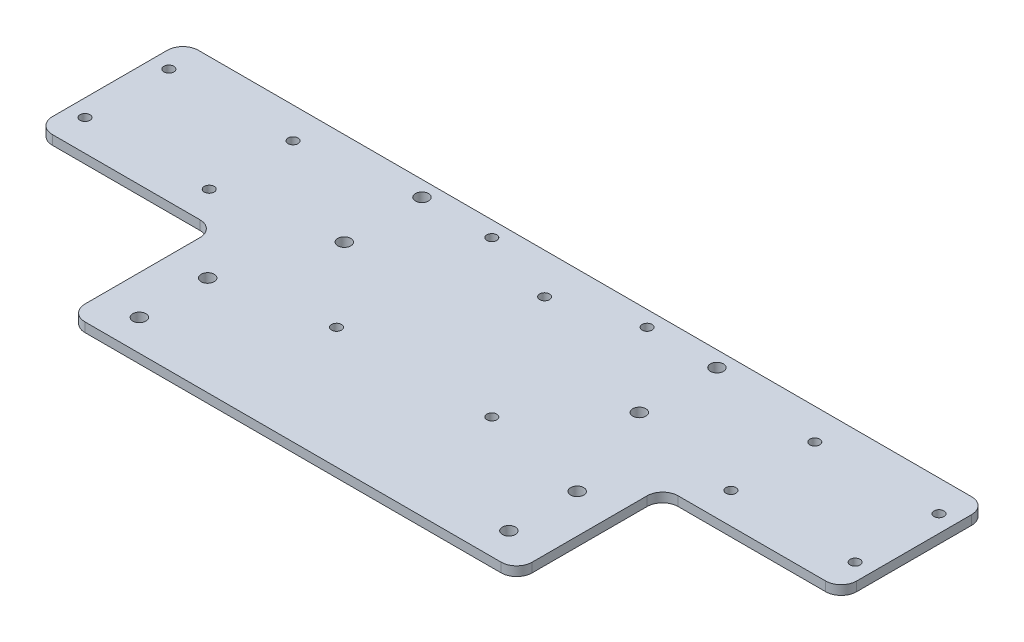
from build123d import *

# Parameters (mm, degrees)
SKETCH_1_R      = 2.1
SKETCH_1_R_2    = 1.6
EXTRUDE_1_DEPTH = 3
FILLET_1_R      = 5


with BuildPart() as part:
    # 草图1 → 凸台-拉伸1 (new body)
    with BuildSketch(Plane.XZ):
        Polygon((-72, 0), (72, 0), (72, -47), (129.5, -47), (129.5, -94), (-129.5, -94), (-129.5, -47), (-72, -47), align=None)
        with Locations((47.5, -89)):
            Circle(SKETCH_1_R, mode=Mode.SUBTRACT)
        with Locations((-124, -84)):
            Circle(SKETCH_1_R_2, mode=Mode.SUBTRACT)
        with Locations((-25, -89)):
            Circle(SKETCH_1_R_2, mode=Mode.SUBTRACT)
        with Locations((-59.5, -32)):
            Circle(SKETCH_1_R, mode=Mode.SUBTRACT)
        with Locations((-25, -39)):
            Circle(SKETCH_1_R_2, mode=Mode.SUBTRACT)
        with Locations((84, -84)):
            Circle(SKETCH_1_R_2, mode=Mode.SUBTRACT)
        with Locations((-59.5, -10)):
            Circle(SKETCH_1_R, mode=Mode.SUBTRACT)
        with Locations((47.5, -64)):
            Circle(SKETCH_1_R, mode=Mode.SUBTRACT)
        with Locations((-84, -57)):
            Circle(SKETCH_1_R_2, mode=Mode.SUBTRACT)
        with Locations((-124, -57)):
            Circle(SKETCH_1_R_2, mode=Mode.SUBTRACT)
        with Locations((-47.5, -64)):
            Circle(SKETCH_1_R, mode=Mode.SUBTRACT)
        with Locations((-84, -84)):
            Circle(SKETCH_1_R_2, mode=Mode.SUBTRACT)
        with Locations((124, -57)):
            Circle(SKETCH_1_R_2, mode=Mode.SUBTRACT)
        with Locations((84, -57)):
            Circle(SKETCH_1_R_2, mode=Mode.SUBTRACT)
        with Locations((59.5, -10)):
            Circle(SKETCH_1_R, mode=Mode.SUBTRACT)
        with Locations((25, -39)):
            Circle(SKETCH_1_R_2, mode=Mode.SUBTRACT)
        with Locations((59.5, -32)):
            Circle(SKETCH_1_R, mode=Mode.SUBTRACT)
        with Locations((25, -89)):
            Circle(SKETCH_1_R_2, mode=Mode.SUBTRACT)
        with Locations((124, -84)):
            Circle(SKETCH_1_R_2, mode=Mode.SUBTRACT)
        with Locations((0, -81)):
            Circle(SKETCH_1_R_2, mode=Mode.SUBTRACT)
        with Locations((-47.5, -89)):
            Circle(SKETCH_1_R, mode=Mode.SUBTRACT)
    extrude(amount=-EXTRUDE_1_DEPTH)

    # 圆角1
    fillet_1_edges = [part.edges().sort_by_distance(p)[0] for p in [
        (72, 1.5, 0),
        (72, 1.5, -47),
        (129.5, 1.5, -47),
        (129.5, 1.5, -94),
        (-129.5, 1.5, -94),
        (-129.5, 1.5, -47),
        (-72, 1.5, -47),
        (-72, 1.5, 0),
    ]]
    fillet(fillet_1_edges, radius=FILLET_1_R)


solid = part.part
